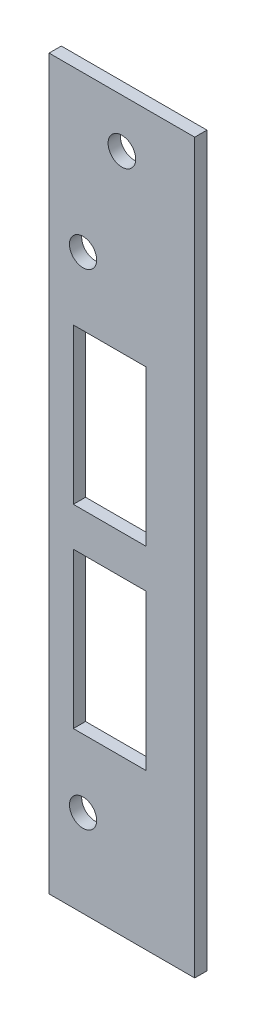
from build123d import *

# Parameters (mm, degrees)
SKETCH1_W          = 19.05
SKETCH1_H          = 95.25
EXTRUDE1_DEPTH     = 1.6002
SKETCH2_R          = 1.8034
CUT_EXTRUDE1_DEPTH = 1.6002
SKETCH3_R          = 1.778
CUT_EXTRUDE2_DEPTH = 2.54
SKETCH4_W          = 9.525
SKETCH4_H          = 20.32
FIBER_HOLES_DEPTH  = 2.54


with BuildPart() as part:
    # Sketch1 → Extrude1 (new body)
    with BuildSketch(Plane.XY):
        with Locations((9.525, -47.625)):
            Rectangle(SKETCH1_W, SKETCH1_H)
    extrude(amount=EXTRUDE1_DEPTH)

    # Sketch2 → Cut-Extrude1 (cut)
    with BuildSketch(Plane.XY.offset(1.6002)):
        with Locations((9.525, -6.35)):
            Circle(SKETCH2_R)
    extrude(amount=-CUT_EXTRUDE1_DEPTH, mode=Mode.SUBTRACT)

    # Sketch3 → Cut-Extrude2 (cut)
    with BuildSketch(Plane.XY.offset(1.6002)):
        with Locations((4.445, -20.32)):
            Circle(SKETCH3_R)
        with Locations((4.445, -83.82)):
            Circle(SKETCH3_R)
    extrude(amount=-CUT_EXTRUDE2_DEPTH, mode=Mode.SUBTRACT)

    # Sketch4 → Fiber Holes (cut)
    with BuildSketch(Plane.XY.offset(1.6002)):
        with Locations((7.9375, -39.37)):
            Rectangle(SKETCH4_W, SKETCH4_H)
        with Locations((7.9375, -64.77)):
            Rectangle(SKETCH4_W, SKETCH4_H)
    extrude(amount=-FIBER_HOLES_DEPTH, mode=Mode.SUBTRACT)


solid = part.part
